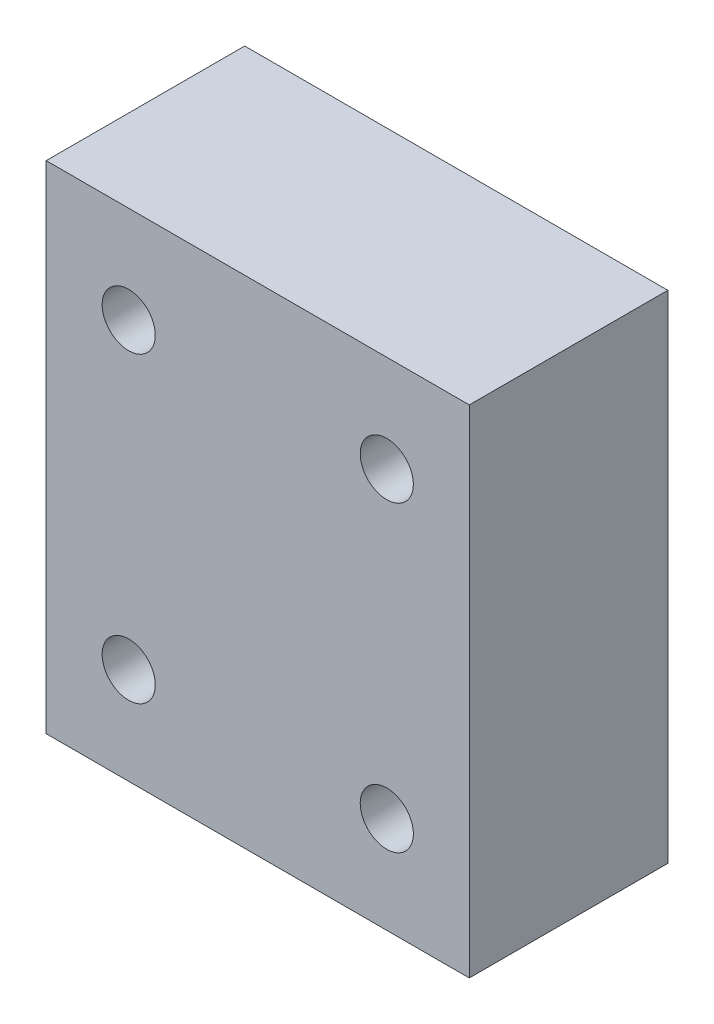
from build123d import *

# Parameters (mm, degrees)
SKETCH1_W           = 42.62295082
SKETCH1_H           = 50
SKETCH1_R           = 2.677018134
BOSS_EXTRUDE1_DEPTH = 20
SKETCH2_R           = 8.73
CUT_EXTRUDE2_DEPTH  = 7.94


with BuildPart() as part:
    # Sketch1 → Boss-Extrude1 (new body)
    with BuildSketch(Plane.XY):
        Rectangle(SKETCH1_W, SKETCH1_H)
        with Locations((-13, -15.25)):
            Circle(SKETCH1_R, mode=Mode.SUBTRACT)
        with Locations((13, -15.25)):
            Circle(SKETCH1_R, mode=Mode.SUBTRACT)
        with Locations((13, 15.25)):
            Circle(SKETCH1_R, mode=Mode.SUBTRACT)
        with Locations((-13, 15.25)):
            Circle(SKETCH1_R, mode=Mode.SUBTRACT)
    extrude(amount=BOSS_EXTRUDE1_DEPTH)

    # Sketch2 → Cut-Extrude2 (cut)
    with BuildSketch(Plane.XY):
        Circle(SKETCH2_R)
    extrude(amount=CUT_EXTRUDE2_DEPTH, mode=Mode.SUBTRACT)


solid = part.part
